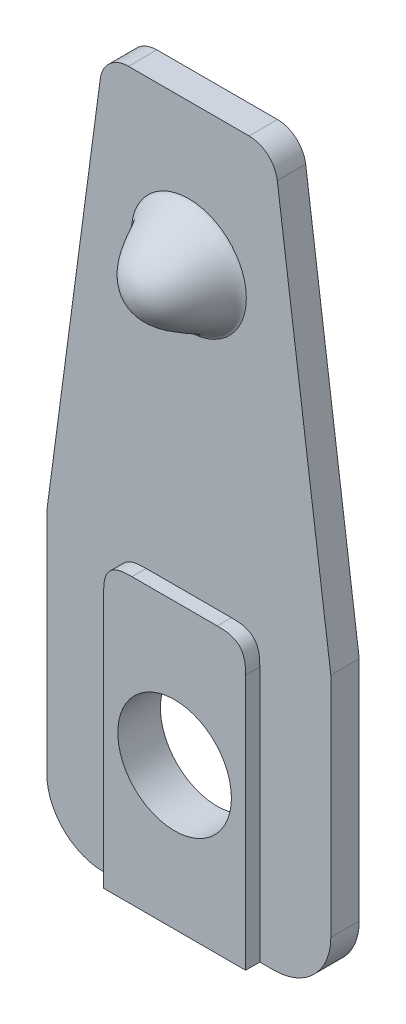
from build123d import *

# Parameters (mm, degrees)
BOSS_EXTRUDE1_DEPTH     = 1
SKETCH4_W               = 5
SKETCH4_H               = 10
BOSS_EXTRUDE2_DEPTH     = 0.5
CUT_EXTRUDE2_DEPTH      = 19.842742091
CUT_EXTRUDE2_DEPTH_BACK = 19.842742091
SKETCH3_R               = 2
FILLET1_SIZE            = 1


with BuildPart() as part:
    # Sketch1 → Boss-Extrude1 (new body)
    with BuildSketch(Plane.XY):
        with BuildLine():
            Line((-3, -6.860294118), (3, -6.860294118))
            ThreePointArc((3, -6.860294118), (4.414213562, -6.27450768), (5, -4.860294118))
            Line((5, -4.860294118), (5, 3.139705882))
            Line((5, 3.139705882), (3.115711504, 17.271869602))
            ThreePointArc((3.115711504, 17.271869602), (2.783208235, 17.89209), (2.124483603, 18.139705882))
            Line((2.124483603, 18.139705882), (-2.124483603, 18.139705882))
            ThreePointArc((-2.124483603, 18.139705882), (-2.783208235, 17.89209), (-3.115711504, 17.271869602))
            Line((-3.115711504, 17.271869602), (-5, 3.139705882))
            Line((-5, 3.139705882), (-5, -4.860294118))
            ThreePointArc((-5, -4.860294118), (-4.414213562, -6.27450768), (-3, -6.860294118))
        make_face()
    extrude(amount=BOSS_EXTRUDE1_DEPTH)

    # Sketch4 → Boss-Extrude2 (add)
    with BuildSketch(Plane.XY.offset(1)):
        with Locations((0, -1.860294118)):
            Rectangle(SKETCH4_W, SKETCH4_H)
    extrude(amount=BOSS_EXTRUDE2_DEPTH)

    # Sketch3 → Cut-Extrude2 (cut, two sides: drawn at the far end of the back side and taken through both)
    with BuildSketch(Plane.XY.offset(1).offset(-CUT_EXTRUDE2_DEPTH_BACK)):
        with Locations((0, -1.860294118)):
            Circle(SKETCH3_R)
    extrude(amount=CUT_EXTRUDE2_DEPTH + CUT_EXTRUDE2_DEPTH_BACK, mode=Mode.SUBTRACT)

    # Sketch10 → Revolve1 (revolve)
    with BuildSketch(Plane.ZY):
        with BuildLine():
            Line((3, 13.139705882), (1, 13.139705882))
            Line((1, 13.139705882), (1, 15.164832594))
            add(Edge.make_bspline(
                [(1, 15.164832594), (1.103472507, 14.776659397), (2.95133834, 14.490964633), (3, 13.139705882)],
                knots=[0, 0, 0, 0, 1, 1, 1, 1], degree=3))
        make_face()
    revolve(axis=Axis((0, 13.139705882, 3), (0, 0, -1)))

    # Fillet1
    # a fillet whose section is not a circle: 1 mm, written as the material it takes off along each edge
    with BuildSketch(Plane(origin=(2.5, 3.139705882, 1), x_dir=(-1, 0, 0), z_dir=(0, 0, 1)), Plane(origin=(-2.5, 3.139705882, 1), x_dir=(0, -1, 0), z_dir=(0, 0, 1))) as fillet1_piece_1:
        with BuildLine():
            add(Edge.make_bspline([(FILLET1_SIZE, 0), (FILLET1_SIZE * 0.831801948466, 0), (FILLET1_SIZE * 0.663603896932, 0), (FILLET1_SIZE * 0.292893218813, FILLET1_SIZE * 0.0716919198361), (FILLET1_SIZE * 0.0716919198361, FILLET1_SIZE * 0.292893218813), (0, FILLET1_SIZE * 0.663603896932), (0, FILLET1_SIZE * 0.831801948466), (0, FILLET1_SIZE)], knots=[0, 0, 0, 0, 0, 0, 0.5, 0.5, 1, 1, 1, 1, 1, 1], degree=5))
            Line((0, FILLET1_SIZE), (0, 0))
            Line((0, 0), (FILLET1_SIZE, 0))
        make_face()
    extrude(amount=3, mode=Mode.SUBTRACT)


solid = part.part
